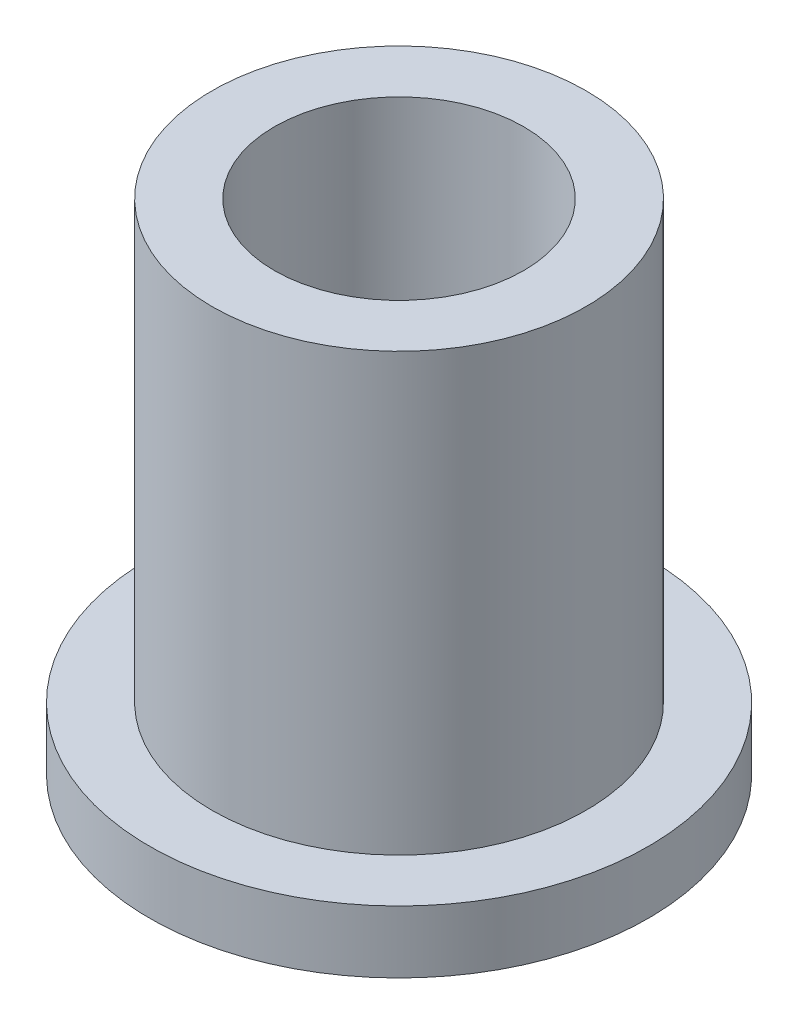
from build123d import *

# Parameters (mm, degrees)
SKETCH1_R           = 4.7625
SKETCH1_R_2         = 3.175
BOSS_EXTRUDE1_DEPTH = 12.7
SKETCH2_R           = 6.35
SKETCH2_R_2         = 4.7625
BOSS_EXTRUDE2_DEPTH = 1.5875


with BuildPart() as part:
    # Sketch1 → Boss-Extrude1 (new body)
    with BuildSketch(Plane(origin=(0, 0, 0), x_dir=(1, 0, 0), z_dir=(0, 1, 0))):
        Circle(SKETCH1_R)
        Circle(SKETCH1_R_2, mode=Mode.SUBTRACT)
    extrude(amount=BOSS_EXTRUDE1_DEPTH)

    # Sketch2 → Boss-Extrude2 (add)
    with BuildSketch(Plane.XZ):
        Circle(SKETCH2_R)
        Circle(SKETCH2_R_2, mode=Mode.SUBTRACT)
    extrude(amount=-BOSS_EXTRUDE2_DEPTH)


solid = part.part
